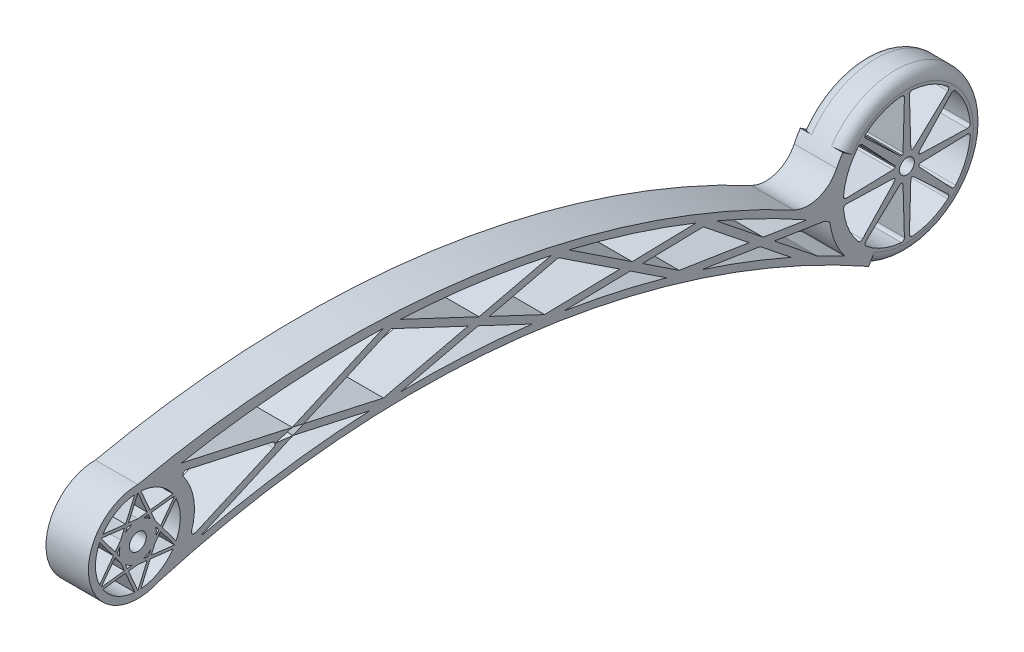
from build123d import *

# Parameters (mm, degrees)
SZKIC1_R                    = 3.0000000000000013
DODANIE_WYCI_GNI_CIE1_DEPTH = 15
WYTNIJ_WYCI_GNI_CIE1_DEPTH  = 10
WYCI_CIE_OBR_T1_ANGLE       = 265.00000000000114
SZKIC4_R                    = 2.6413389418962936
WYTNIJ_WYCI_GNI_CIE2_DEPTH  = 303.97760364050646
ZAOKR_GLENIE2_R             = 1
ZAOKR_GLENIE3_R             = 1


with BuildPart() as part:
    # Szkic1 → Dodanie-wyciągnięcie1 (new body)
    with BuildSketch(Plane(origin=(0, 0, 0), x_dir=(0, 0, -1), z_dir=(1, 0, 0))):
        with BuildLine():
            ThreePointArc((247.14386905317215, 8.669867048888815), (240.61406501931535, 2.878072518954692), (231.9153380807969, 3.595968226311193))
            ThreePointArc((231.91533808079674, 3.595968226310845), (118.77075205195764, 40.0073705160612), (-1.1369e-13, 35.42522894734333))
            ThreePointArc((-4.263e-14, 35.42522894734323), (-17.11785435479439, 14.288051155696689), (7.115506251416886, 1.9371217802628404))
            ThreePointArc((7.115506251417315, 1.9371217802620322), (135.74126507971314, 12.768875604402524), (258.5290498333885, -27.044095150701935))
            ThreePointArc((258.5290498333885, -27.04409515070196), (298.2105787910556, 5.277608418992131), (247.14386905317215, 8.66986704888883))
        make_face()
        with BuildLine():
            Line((86.71196287585684, 39.85172014852097), (54.59601640433131, 25.63196779323211))
            Line((54.59601640433131, 25.63196779323211), (15.371259061907589, 34.30375562276811))
            ThreePointArc((15.371259061907566, 34.303755622767994), (50.88983633712013, 39.02939222675377), (86.71196287585684, 39.85172014852026))
        make_face(mode=Mode.SUBTRACT)
        with BuildLine():
            Line((120.66797341458721, 26.474058591359295), (92.81176762409336, 39.601392917780196))
            ThreePointArc((92.81176762409333, 39.601392917779435), (119.64227628793515, 37.141826382467116), (146.18032427133483, 32.48804599090431))
            Line((146.18032427133505, 32.488045990905256), (120.66797341458721, 26.474058591359295))
        make_face(mode=Mode.SUBTRACT)
        with BuildLine():
            Line((174.84991399733929, 16.273435518201048), (152.4856105962059, 31.04790711767739))
            ThreePointArc((152.48561059620565, 31.047907117676345), (175.25117753037594, 24.736599669939665), (197.5033063836007, 16.802722872715833))
            Line((197.5033063836011, 16.80272287271687), (174.84991399733929, 16.27343551820105))
        make_face(mode=Mode.SUBTRACT)
        with BuildLine():
            Line((221.16225750591792, 0.6095847652137945), (204.59999742397423, 13.883762677302833))
            ThreePointArc((204.59999742397383, 13.883762677301888), (220.82030475857567, 6.4620426304150556), (236.61307264849492, -1.8306517965149283))
            Line((236.61307264849543, -1.8306517965140139), (221.16225750591792, 0.6095847652137937))
        make_face(mode=Mode.SUBTRACT)
        with BuildLine():
            Line((225.09519841335046, -2.5425549225277746), (242.68994389251247, -5.321394797080412))
            ThreePointArc((242.68994389251213, -5.321394797081041), (243.70994318234705, -5.924383596068367), (244.72775709192354, -6.531053925358094))
            ThreePointArc((244.72775709192354, -6.531053925358092), (246.52918688549187, -13.418645500219824), (250.03832796582145, -19.612997434167806))
            ThreePointArc((250.0383279658215, -19.612997434167767), (245.23804821382785, -17.17093269826796), (240.39847516681735, -14.807693693347915))
            Line((240.39847516681735, -14.807693693347897), (225.09519841335046, -2.5425549225277746))
        make_face(mode=Mode.SUBTRACT)
        with BuildLine():
            Line((21.948305518804606, 8.442680568326235), (54.857709427131326, 23.013746507531437))
            Line((54.857709427131326, 23.013746507531433), (81.99464077533202, 17.014328615868333))
            ThreePointArc((81.99464077533202, 17.01432861586835), (51.77371634755495, 14.113835746266773), (21.948305518804602, 8.442680568326239))
        make_face(mode=Mode.SUBTRACT)
        with BuildLine():
            Line((92.96645720572906, 17.375501728865885), (120.39190957994006, 23.84046161952725))
            Line((120.39190957994006, 23.84046161952725), (139.5065287687862, 14.832630527906328))
            ThreePointArc((139.50652876878618, 14.832630527906247), (116.2815352131982, 16.92843679169067), (92.96645720572909, 17.375501728865856))
        make_face(mode=Mode.SUBTRACT)
        with BuildLine():
            Line((150.7937254579246, 13.21069011139366), (174.1253511988679, 13.755824114037251))
            Line((174.1253511988679, 13.755824114037251), (186.99309654488957, 5.255038967541919))
            ThreePointArc((186.99309654488957, 5.25503896754185), (169.00541672809712, 9.742506904499237), (150.7937254579246, 13.21069011139366))
        make_face(mode=Mode.SUBTRACT)
        with BuildLine():
            Line((199.43547561853376, 1.5100334457813434), (220.11666851402651, -1.7562669130035622))
            Line((220.11666851402651, -1.756266913003562), (231.03905749577325, -10.510249391929378))
            ThreePointArc((231.03905749577322, -10.510249391929449), (215.39163289755328, -4.09424986276332), (199.4354756185338, 1.510033445781346))
        make_face(mode=Mode.SUBTRACT)
        with BuildLine():
            Line((14.20879918361564, 32.00038527896806), (50.73912779284115, 23.924280275258774))
            Line((50.73912779284115, 23.924280275258774), (18.132963053328133, 9.487477415884612))
            ThreePointArc((18.13296305332884, 9.487477415884284), (19.702922404067348, 21.3595918779787), (14.20879918361539, 32.000385278967805))
        make_face(mode=Mode.SUBTRACT)
        Polygon((86.8479757216951, 18.501722324906066), (58.71459803862148, 24.72143402550476), (89.55066806325941, 38.374504463564634), (116.75883122700434, 25.552562489680405), align=None, mode=Mode.SUBTRACT)
        Polygon((178.505925039154, 13.858174450783848), (200.0076292842972, 14.360553077500999), (216.1837276065938, 1.3958727747381339), (191.4594501274222, 5.300720856229939), align=None, mode=Mode.SUBTRACT)
        Polygon((143.8506317788958, 15.549149821934162), (124.30105176752294, 24.761957721206137), (148.74353553806114, 30.523746990843186), (170.46934015705276, 16.17108518145446), align=None, mode=Mode.SUBTRACT)
        with Locations((0, 17.925228947343225)):
            Circle(SZKIC1_R, mode=Mode.SUBTRACT)
    extrude(amount=DODANIE_WYCI_GNI_CIE1_DEPTH)

    # Szkic2 → Wytnij-wyciągnięcie1 (cut)
    with BuildSketch(Plane(origin=(15, 0, 0), x_dir=(0, 0, -1), z_dir=(1, 0, 0))):
        Polygon((-4.749370526585766, 24.47363901774454), (-6.067932211414769, 21.428551243027943), (-8.04577473865806, 18.764099440151195), (-12.990381056766234, 25.425228947343374), align=None)
        with BuildLine():
            Line((-8.6684745877329, 17.92522894734628), (-13.508653760358897, 24.44567935990994))
            ThreePointArc((-13.508653760358897, 24.44567935990994), (-15, 17.925228947345317), (-13.508653760360717, 11.40477853478028))
            Line((-13.508653760360717, 11.40477853478028), (-8.6684745877329, 17.92522894734628))
        make_face()
        with BuildLine():
            Line((-6.355965996783881, 19.362785362535288), (-7.42307488958084, 17.925228947343307))
            Line((-7.42307488958084, 17.925228947343307), (-6.355965996783897, 16.487672532151286))
            ThreePointArc((-6.355965996783898, 16.487672532151286), (-6.516507668923027, 17.92522894734329), (-6.35596599678387, 19.362785362535284))
        make_face()
        with BuildLine():
            Line((-3.711537444790369, 24.353800375914847), (-4.422943373321874, 22.710878758551807))
            ThreePointArc((-4.422943373321875, 22.710878758551807), (-3.258253834461477, 23.568690132586703), (-1.9330226234618175, 24.148435173744325))
            Line((-1.9330226234618204, 24.148435173744335), (-3.711537444790369, 24.353800375914847))
        make_face()
        with BuildLine():
            Line((3.711537444790358, 24.353800375914872), (1.9330226234613614, 24.148435173744467))
            ThreePointArc((1.9330226234613608, 24.148435173744467), (3.2582538344613576, 23.56869013258677), (4.422943373322022, 22.710878758551672))
            Line((4.422943373322023, 22.710878758551672), (3.711537444790358, 24.353800375914872))
        make_face()
        with BuildLine():
            Line((7.4230748895808, 17.925228947343463), (6.355965996783689, 19.36278536253609))
            ThreePointArc((6.355965996783688, 19.36278536253609), (6.476247885951691, 18.648475460531408), (6.516507668923027, 17.925228947343225))
            ThreePointArc((6.516507668923027, 17.925228947343225), (6.476247885951745, 17.201982434155514), (6.355965996783897, 16.487672532151283))
            Line((6.355965996783897, 16.487672532151283), (7.4230748895808, 17.925228947343463))
        make_face()
        with BuildLine():
            ThreePointArc((4.422943373321714, 13.139579136134493), (3.2582538344618652, 12.281767762099971), (1.9330226234628807, 11.702022720942455))
            Line((1.9330226234628818, 11.702022720942455), (3.7115374447905536, 11.496657518772196))
            Line((3.7115374447905536, 11.496657518772196), (4.422943373321715, 13.139579136134497))
        make_face()
        with BuildLine():
            ThreePointArc((-1.9330226234626287, 11.702022720942377), (-3.258253834461411, 12.281767762099712), (-4.422943373321141, 13.139579136133964))
            Line((-4.422943373321139, 13.139579136133964), (-3.71153744479015, 11.49665751877212))
            Line((-3.71153744479015, 11.49665751877212), (-1.9330226234626273, 11.702022720942377))
        make_face()
        Polygon((-12.990381056766198, 10.425228947343442), (-4.749370526581913, 11.376818876942833), (-6.0679322114113035, 14.421906651660326), (-8.045774738655652, 17.08635845453843), align=None)
        Polygon((3.296404212072303, 25.31250951055219), (-1.50201e-11, 24.931873538710896), (-3.296404212073718, 25.312509510548917), (0, 32.92522894734322), align=None)
        with BuildLine():
            ThreePointArc((12.401202581576591, 26.36384106846232), (7.499999999999998, 30.915610004109805), (1.1074511787841261, 32.88429148102526))
            Line((1.107451178784127, 32.88429148102526), (4.334237293867699, 25.432348152381884))
            Line((4.3342372938677, 25.432348152381884), (12.40120258157659, 26.36384106846232))
        make_face()
        with BuildLine():
            ThreePointArc((-1.1074511787841275, 32.88429148102526), (-7.500000000001618, 30.91561000410887), (-12.401202581578698, 26.363841068459223))
            Line((-12.401202581578696, 26.363841068459223), (-4.334237293869107, 25.432348152378626))
            Line((-4.334237293869108, 25.432348152378626), (-1.107451178784128, 32.884291481025265))
        make_face()
        Polygon((12.990381056766461, 25.425228947343413), (4.749370526585762, 24.47363901774456), (6.067932211414603, 21.42855124302833), (8.04577473865805, 18.764099440151334), align=None)
        with BuildLine():
            ThreePointArc((15, 17.925228947343225), (14.622410991444106, 21.269641720506044), (13.508653760360719, 24.445679359906165))
            Line((13.508653760360717, 24.445679359906165), (8.668474587735332, 17.925228947343403))
            Line((8.668474587735332, 17.925228947343403), (13.508653760360719, 11.40477853478029))
            ThreePointArc((13.508653760360719, 11.404778534780288), (14.622410991444108, 14.580816174180413), (15, 17.92522894734322))
        make_face()
        Polygon((4.749370526585941, 11.3768188769425), (6.067932211414883, 14.421906651659038), (8.045774738658086, 17.08635845453556), (12.990381056766541, 10.425228947343602), align=None)
        with BuildLine():
            Line((-4.3342372938637315, 10.418109742305223), (-12.401202581576582, 9.48661682622412))
            ThreePointArc((-12.401202581576586, 9.486616826224122), (-7.49999999999809, 4.9348478905755435), (-1.1074511787797334, 2.966166413660863))
            Line((-1.107451178779732, 2.966166413660864), (-4.334237293863731, 10.418109742305223))
        make_face()
        Polygon((2.5337e-13, 2.9252289473436637), (3.2964042120724173, 10.537948384134655), (3.8684e-13, 10.918584355974176), (-3.296404212071974, 10.537948384134525), align=None)
        with BuildLine():
            Line((4.334237293867797, 10.418109742304964), (1.1074511787841348, 2.966166413661188))
            ThreePointArc((1.107451178784139, 2.96616641366119), (7.500000000000208, 4.934847890576766), (12.401202581576863, 9.48661682622453))
            Line((12.401202581576863, 9.486616826224532), (4.334237293867796, 10.418109742304964))
        make_face()
    extrude(amount=-WYTNIJ_WYCI_GNI_CIE1_DEPTH, mode=Mode.SUBTRACT)

    # Szkic3 → Wycięcie-obrót1 (revolve, cut)
    with BuildSketch(Plane(origin=(0, -116.95960868066354, -207.9590871503928), x_dir=(1, 0, 0), z_dir=(0, 0.49020591019126136, 0.8716066576234701))):
        with BuildLine():
            ThreePointArc((14.999999999999996, 107.16065480170373), (13.82842712474619, 104.33222767695754), (11.000000000000004, 103.16065480170373))
            Line((11.000000000000004, 103.16065480170374), (15, 103.16065480170374))
            Line((15, 103.16065480170374), (15, 107.16065480170373))
        make_face()
        with BuildLine():
            Line((0, 103.16065480170374), (3.9999999999999973, 103.16065480170374))
            ThreePointArc((3.9999999999999973, 103.16065480170373), (1.1715728752538102, 104.33222767695754), (1.78e-15, 107.16065480170373))
            Line((0, 107.16065480170373), (0, 103.16065480170374))
        make_face()
    revolve(axis=Axis((15, -3.0749120660565206, -272.0097123636482), (1, 0, 0)), revolution_arc=WYCI_CIE_OBR_T1_ANGLE, mode=Mode.SUBTRACT)

    # Szkic4 → Wytnij-wyciągnięcie2 (cut, through all)
    with BuildSketch(Plane.ZY):
        with BuildLine():
            Line((-276.28696164373895, -4.473174772404359), (-294.49354358999744, -3.9277504945065007))
            ThreePointArc((-294.49354358999744, -3.9277504945064985), (-292.7970018451521, -11.68528929427105), (-288.51122972686704, -18.3703337572485))
            Line((-288.51122972686704, -18.370333757248503), (-276.02290537596446, -5.1106629952951685))
            ThreePointArc((-276.02290537596446, -5.1106629952951685), (-276.167170259949, -4.796987511699434), (-276.28696164373895, -4.473174772404361))
        make_face()
        with BuildLine():
            ThreePointArc((-288.51122972686704, 12.220509625135447), (-292.7970018451521, 5.535465162158003), (-294.49354358999744, -2.222073637606548))
            Line((-294.49354358999744, -2.222073637606547), (-276.28696164373895, -1.6766493597086827))
            ThreePointArc((-276.28696164373895, -1.6766493597086796), (-276.167170259949, -1.3528366204136075), (-276.02290537596446, -1.0391611368178704))
            Line((-276.02290537596446, -1.0391611368178726), (-288.51122972686704, 12.220509625135435))
        make_face()
        with BuildLine():
            Line((-274.04546329288684, -7.0881050783727915), (-287.30513405484015, -19.5764294292754))
            ThreePointArc((-287.30513405484015, -19.57642942927539), (-280.6200895918627, -23.86220154756045), (-272.8625507920982, -25.55874329240578))
            Line((-272.8625507920982, -25.558743292405815), (-273.40797506999604, -7.352161346147302))
            ThreePointArc((-273.40797506999604, -7.352161346147286), (-273.7317878092911, -7.232369962357328), (-274.04546329288684, -7.088105078372793))
        make_face()
        with BuildLine():
            ThreePointArc((-272.86255079209815, 19.408919160292744), (-280.62008959186267, 17.71237741544742), (-287.30513405484015, 13.426605297162352))
            Line((-287.30513405484015, 13.426605297162359), (-274.04546329288684, 0.9382809462597503))
            ThreePointArc((-274.04546329288684, 0.9382809462597517), (-273.73178780929106, 1.0825458302442947), (-273.407975069996, 1.2023372140342583))
            Line((-273.407975069996, 1.2023372140342339), (-272.86255079209815, 19.408919160292747))
        make_face()
        with BuildLine():
            Line((-270.6114496573004, -7.352161346147302), (-271.15687393519823, -25.558743292405815))
            ThreePointArc((-271.15687393519823, -25.558743292405783), (-263.3993351354337, -23.86220154756046), (-256.71429067245623, -19.576429429275397))
            Line((-256.71429067245623, -19.5764294292754), (-269.97396143440955, -7.0881050783727915))
            ThreePointArc((-269.97396143440955, -7.088105078372795), (-270.2876369180053, -7.232369962357339), (-270.6114496573004, -7.352161346147303))
        make_face()
        with BuildLine():
            ThreePointArc((-256.71429067245623, 13.426605297162352), (-263.39933513543366, 17.71237741544741), (-271.1568739351982, 19.40891916029274))
            Line((-271.1568739351982, 19.408919160292747), (-270.6114496573003, 1.2023372140342339))
            ThreePointArc((-270.6114496573003, 1.2023372140342246), (-270.2876369180052, 1.0825458302442645), (-269.9739614344095, 0.9382809462597286))
            Line((-269.9739614344095, 0.9382809462597503), (-256.71429067245623, 13.426605297162359))
        make_face()
        with BuildLine():
            Line((-267.99651935133187, -5.1106629952951685), (-255.5081950004293, -18.370333757248503))
            ThreePointArc((-255.50819500042934, -18.370333757248492), (-251.22242288214426, -11.68528929427105), (-249.52588113729894, -3.927750494506487))
            Line((-249.5258811372989, -3.927750494506492), (-267.7324630835575, -4.473174772404358))
            ThreePointArc((-267.73246308355743, -4.473174772404381), (-267.8522544673474, -4.796987511699431), (-267.9965193513319, -5.110662995295149))
        make_face()
        with BuildLine():
            ThreePointArc((-249.52588113729894, -2.222073637606534), (-251.22242288214426, 5.535465162158001), (-255.50819500042934, 12.220509625135442))
            Line((-255.5081950004293, 12.220509625135461), (-267.9965193513318, -1.0391611368178726))
            ThreePointArc((-267.9965193513319, -1.039161136817916), (-267.8522544673474, -1.3528366204136228), (-267.73246308355743, -1.6766493597086622))
            Line((-267.7324630835575, -1.6766493597086818), (-249.52588113729902, -2.2220736376065378))
        make_face()
        with Locations((-272.0097123636482, -3.074912066056521)):
            Circle(SZKIC4_R)
    extrude(amount=-WYTNIJ_WYCI_GNI_CIE2_DEPTH, mode=Mode.SUBTRACT)

    # Zaokrąglenie2
    # the kernel refuses this fillet: 1 mm, written as the material it adds along each edge
    with BuildSketch(Plane(origin=(0, -1.0391611368178943, -267.99651935133187), x_dir=(0, 0.7279633723747813, 0.6856160211669035), z_dir=(1, 0, 0))) as zaokr_glenie2_piece_1:
        with BuildLine():
            CenterArc((0.6523105054833352, 1.0000000000000013), ZAOKR_GLENIE2_R, 207.33683466870096, 62.663165331297364)
            ThreePointArc((-0.2360116840668876, 0.5407792605372268), (-0.10913296990104362, 0.27426200786756466), (0, 0))
            Line((0, 0), (0.652310505483306, 2e-17))
        make_face()
    extrude(amount=15)
    with BuildSketch(Plane(origin=(0, -1.6766493597086718, -267.7324630835575), x_dir=(0, -0.0299440992044147, 0.9995515749188914), z_dir=(1, 0, 0))) as zaokr_glenie2_piece_2:
        with BuildLine():
            CenterArc((0.6523105054834588, -0.9999999999999998), ZAOKR_GLENIE2_R, 89.99999999999834, 62.663165331299226)
            ThreePointArc((-0.23601168406674122, -0.5407792605372082), (-0.10913296990095891, -0.27426200786755334), (0, 0))
            Line((0, 0), (0.652310505483488, 0))
        make_face()
    extrude(amount=15)
    with BuildSketch(Plane(origin=(0, 12.22050962513545, -255.50819500042934), x_dir=(0, -0.7279633723747962, -0.6856160211668874), z_dir=(1, 0, 0))) as zaokr_glenie2_piece_3:
        with BuildLine():
            CenterArc((1.0970810552204335, -1.000000000000001), ZAOKR_GLENIE2_R, 89.99999999999959, 96.74640415342816)
            ThreePointArc((0.10400522364914143, -1.117475072883543), (0.04503404236574343, -0.5593861125421823), (0, 0))
            Line((0, 0), (1.0970810552204406, -2e-17))
        make_face()
    extrude(amount=15)
    with BuildSketch(Plane(origin=(0, -2.222073637606536, -249.525881137299), x_dir=(0, 0.9980252307388967, -0.0628143200916175), z_dir=(1, 0, 0))) as zaokr_glenie2_piece_4:
        with BuildLine():
            CenterArc((1.0973645020845546, -0.999688947271241), ZAOKR_GLENIE2_R, 88.57088921708781, 96.74640415350945)
            Line((0.10166772912290006, -1.0923600663631525), (0, 0))
            ThreePointArc((0, 0), (0.5611523022023575, 0.00699868639733426), (1.1223046044047162, 0))
        make_face()
    extrude(amount=15)
    with BuildSketch(Plane(origin=(0, -7.0881050783727915, -269.97396143440955), x_dir=(0, -0.3929483772979695, -0.9195605324169217), z_dir=(1, 0, 0))) as zaokr_glenie2_piece_5:
        with BuildLine():
            CenterArc((0.6555967253016459, -0.9978486505165693), ZAOKR_GLENIE2_R, 93.75898856175243, 62.66316533129816)
            Line((-0.26092073406317673, -0.597853967202595), (0, 0))
            ThreePointArc((0, 0), (0.29501852638574716, -0.00968107267543209), (0.5900370527714927, -2e-17))
        make_face()
    extrude(amount=15)
    with BuildSketch(Plane(origin=(0, -7.352161346147303, -270.6114496573004), x_dir=(0, -0.9995515749188927, -0.029944099204370734), z_dir=(1, 0, 0))) as zaokr_glenie2_piece_6:
        with BuildLine():
            CenterArc((0.6523105054833831, -0.9999999999999907), ZAOKR_GLENIE2_R, 90.00000000000158, 62.66316533129891)
            ThreePointArc((-0.2360116840668347, -0.5407792605372477), (-0.10913296990101062, -0.2742620078676106), (0, 0))
            Line((0, 0), (0.6523105054833557, 0))
        make_face()
    extrude(amount=15)
    with BuildSketch(Plane(origin=(0, -19.576429429275393, -256.71429067245623), x_dir=(0, 0.6856160211668924, -0.7279633723747916), z_dir=(1, 0, 0))) as zaokr_glenie2_piece_7:
        with BuildLine():
            CenterArc((1.0970810552251236, -0.9999999999999961), ZAOKR_GLENIE2_R, 89.99999999999919, 96.74640415342623)
            ThreePointArc((0.10400522365383967, -1.1174750728834957), (0.04503404236578149, -0.5593861125424465), (0, 0))
            Line((0, 0), (1.0970810552251378, 0))
        make_face()
    extrude(amount=15)
    with BuildSketch(Plane(origin=(0, -4.473174772404369, -267.7324630835575), x_dir=(0, 0.029944099204419008, 0.9995515749188914), z_dir=(1, 0, 0))) as zaokr_glenie2_piece_8:
        with BuildLine():
            CenterArc((0.6523105054833979, 1.0000000000000002), ZAOKR_GLENIE2_R, 207.33683466870332, 62.663165331298615)
            ThreePointArc((-0.2360116840668, 0.5407792605371928), (-0.10913296990096008, 0.2742620078675522), (0, 0))
            Line((0, 0), (0.6523105054834313, 0))
        make_face()
    extrude(amount=15)
    with BuildSketch(Plane(origin=(0, -7.0881050783727915, -274.04546329288684), x_dir=(0, -0.6856160211668986, -0.7279633723747856), z_dir=(1, 0, 0))) as zaokr_glenie2_piece_9:
        with BuildLine():
            CenterArc((0.652310505483376, -0.9999999999999973), ZAOKR_GLENIE2_R, 90.00000000000139, 62.66316533129475)
            ThreePointArc((-0.2360116840668056, -0.5407792605371874), (-0.10913296990095936, -0.27426200786753413), (0, 0))
            Line((0, 0), (0.6523105054833519, 2e-17))
        make_face()
    extrude(amount=15)
    with BuildSketch(Plane(origin=(0, -7.352161346147294, -273.40797506999604), x_dir=(0, -0.9995515749188927, 0.02994409920437053), z_dir=(1, 0, 0))) as zaokr_glenie2_piece_10:
        with BuildLine():
            CenterArc((0.6523105054833878, 0.9999999999999907), ZAOKR_GLENIE2_R, 207.3368346687031, 62.66316533129532)
            ThreePointArc((-0.23601168406680184, 0.5407792605371918), (-0.10913296990098312, 0.2742620078675546), (0, 0))
            Line((0, 0), (0.65231050548336, 0))
        make_face()
    extrude(amount=15)
    with BuildSketch(Plane(origin=(0, -3.9277504945064896, -249.52588113729894), x_dir=(0, -0.02994409920440287, -0.9995515749188917), z_dir=(1, 0, 0))) as zaokr_glenie2_piece_11:
        with BuildLine():
            CenterArc((1.097081055223315, -1), ZAOKR_GLENIE2_R, 89.99999999999936, 96.74640415355515)
            ThreePointArc((0.10400522365228276, -1.1174750728857392), (0.04503404236584158, -0.5593861125434373), (0, 0))
            Line((0, 0), (1.097081055223326, 0))
        make_face()
    extrude(amount=15)
    with BuildSketch(Plane(origin=(0, -18.370333757248495, -255.50819500042934), x_dir=(0, 0.7501268401431951, 0.6612939767582837), z_dir=(1, 0, 0))) as zaokr_glenie2_piece_12:
        with BuildLine():
            CenterArc((1.0973645020849179, -0.999688947271231), ZAOKR_GLENIE2_R, 88.5708892170913, 96.74640415351087)
            Line((0.10166772912327839, -1.0923600663632267), (0, 0))
            ThreePointArc((0, 0), (0.5611523022025391, 0.00699868639729401), (1.1223046044050182, 0))
        make_face()
    extrude(amount=15)
    with BuildSketch(Plane(origin=(0, 19.40891916029274, -272.86255079209815), x_dir=(0, -0.0628143200916797, -0.9980252307388927), z_dir=(1, 0, 0))) as zaokr_glenie2_piece_13:
        with BuildLine():
            CenterArc((1.0973645020844052, -0.9996889472712321), ZAOKR_GLENIE2_R, 88.57088921709108, 96.74640415349302)
            Line((0.10166772912271652, -1.0923600663629165), (0, 0))
            ThreePointArc((0, 0), (0.5611523022022534, 0.00699868639729153), (1.1223046044045095, -1e-17))
        make_face()
    extrude(amount=15)
    with BuildSketch(Plane(origin=(0, -1.0391611368178713, -276.02290537596446), x_dir=(0, 0.7279633723748022, -0.6856160211668811), z_dir=(1, 0, 0))) as zaokr_glenie2_piece_14:
        with BuildLine():
            CenterArc((0.6523105054834076, -1.0000000000000024), ZAOKR_GLENIE2_R, 89.99999999999986, 62.66316533129617)
            ThreePointArc((-0.2360116840667847, -0.5407792605371852), (-0.10913296990100531, -0.2742620078675173), (0, 0))
            Line((0, 0), (0.6523105054834102, 0))
        make_face()
    extrude(amount=15)
    with BuildSketch(Plane(origin=(0, -4.47317477240436, -276.28696164373895), x_dir=(0, 0.029944099204399964, -0.9995515749188919), z_dir=(1, 0, 0))) as zaokr_glenie2_piece_15:
        with BuildLine():
            CenterArc((0.6523105054834165, -1.0000000000000002), ZAOKR_GLENIE2_R, 89.99999999999919, 62.663165331300476)
            ThreePointArc((-0.23601168406679118, -0.5407792605372461), (-0.10913296990101273, -0.2742620078675881), (0, 0))
            Line((0, 0), (0.6523105054834308, 0))
        make_face()
    extrude(amount=15)
    with BuildSketch(Plane(origin=(0, 12.220509625135442, -288.51122972686704), x_dir=(0, -0.7279633723747974, 0.685616021166886), z_dir=(1, 0, 0))) as zaokr_glenie2_piece_16:
        with BuildLine():
            CenterArc((1.097081055222594, 1.0000000000000022), ZAOKR_GLENIE2_R, 173.2535958464652, 96.74640415353502)
            ThreePointArc((0.10400522365152876, 1.1174750728853988), (0.04503404236581977, 0.5593861125432292), (0, 0))
            Line((0, 0), (1.0970810552225982, 1.1e-16))
        make_face()
    extrude(amount=15)
    with BuildSketch(Plane(origin=(0, -18.370333757248495, -288.51122972686704), x_dir=(0, 0.7501268401431492, -0.6612939767583358), z_dir=(1, 0, 0))) as zaokr_glenie2_piece_17:
        with BuildLine():
            CenterArc((1.0973645020820684, 0.999688947271243), ZAOKR_GLENIE2_R, 174.68270662956036, 96.74640415334648)
            Line((0.10166772912017569, 1.0923600663604138), (0, 0))
            ThreePointArc((0, 0), (0.5611523022011092, -0.0069986863972657), (1.1223046044021363, -4e-17))
        make_face()
    extrude(amount=15)
    with BuildSketch(Plane(origin=(0, -25.558743292405808, -272.8625507920982), x_dir=(0, 0.9995515749188911, -0.029944099204423556), z_dir=(1, 0, 0))) as zaokr_glenie2_piece_18:
        with BuildLine():
            CenterArc((1.0970810552235708, -0.9999999999999907), ZAOKR_GLENIE2_R, 90.00000000000135, 96.74640415371641)
            ThreePointArc((0.10400522365287737, -1.117475072888559), (0.0450340423660103, -0.5593861125448855), (0, 0))
            Line((0, 0), (1.0970810552235473, 0))
        make_face()
    extrude(amount=15)
    with BuildSketch(Plane(origin=(0, -5.1106629952951685, -276.02290537596446), x_dir=(0, 0.919560532416912, -0.3929483772979924), z_dir=(1, 0, 0))) as zaokr_glenie2_piece_19:
        with BuildLine():
            CenterArc((0.6555967253016699, -0.9978486505165827), ZAOKR_GLENIE2_R, 93.75898856175532, 62.66316533129684)
            Line((-0.26092073406316724, -0.5978539672026318), (0, 0))
            ThreePointArc((0, 0), (0.2950185263857061, -0.00968107267540476), (0.5900370527714652, 0))
        make_face()
    extrude(amount=15)
    with BuildSketch(Plane(origin=(0, -1.6766493597086811, -276.28696164373895), x_dir=(0, 0.9280839504271531, 0.3723710259398945), z_dir=(1, 0, 0))) as zaokr_glenie2_piece_20:
        with BuildLine():
            CenterArc((0.655596725301614, -0.9978486505165761), ZAOKR_GLENIE2_R, 93.75898856175117, 62.66316533129951)
            Line((-0.26092073406321087, -0.5978539672026022), (0, 0))
            ThreePointArc((0, 0), (0.29501852638574616, -0.00968107267543258), (0.5900370527714822, -1e-17))
        make_face()
    extrude(amount=15)
    with BuildSketch(Plane(origin=(0, 0.9382809462597499, -274.04546329288684), x_dir=(0, 0.3929483772979587, 0.9195605324169264), z_dir=(1, 0, 0))) as zaokr_glenie2_piece_21:
        with BuildLine():
            CenterArc((0.6555967253016313, -0.9978486505165703), ZAOKR_GLENIE2_R, 93.75898856175176, 62.6631653312982)
            Line((-0.2609207340631863, -0.5978539672025861), (0, 0))
            ThreePointArc((0, 0), (0.2950185263856894, -0.00968107267544525), (0.5900370527714898, -1e-17))
        make_face()
    extrude(amount=15)
    with BuildSketch(Plane(origin=(0, 1.2023372140342476, -273.407975069996), x_dir=(0, -0.37237102593985144, -0.9280839504271703), z_dir=(1, 0, 0))) as zaokr_glenie2_piece_22:
        with BuildLine():
            CenterArc((0.6555967253016637, 0.997848650516569), ZAOKR_GLENIE2_R, 203.57784610694745, 62.66316533129884)
            Line((-0.26092073406316585, 0.597853967202629), (0, 0))
            ThreePointArc((0, 0), (0.29501852638578246, 0.00968107267544045), (0.5900370527714887, 1e-17))
        make_face()
    extrude(amount=15)
    with BuildSketch(Plane(origin=(0, -25.5587432924058, -271.15687393519823), x_dir=(0, 0.9995515749188923, 0.029944099204384587), z_dir=(1, 0, 0))) as zaokr_glenie2_piece_23:
        with BuildLine():
            CenterArc((1.0970810552230614, 0.9999999999999908), ZAOKR_GLENIE2_R, 173.2535958464512, 96.74640415354969)
            ThreePointArc((0.10400522365202086, 1.1174750728856304), (0.04503404236585731, 0.5593861125433557), (0, 0))
            Line((0, 0), (1.097081055223077, 0))
        make_face()
    extrude(amount=15)
    with BuildSketch(Plane(origin=(0, -19.576429429275393, -287.30513405484015), x_dir=(0, -0.6612939767582722, 0.7501268401432053), z_dir=(1, 0, 0))) as zaokr_glenie2_piece_24:
        with BuildLine():
            CenterArc((1.0973645020850624, -0.9996889472712236), ZAOKR_GLENIE2_R, 88.57088921709014, 96.74640415347397)
            Line((0.10166772912333646, -1.0923600663625608), (0, 0))
            ThreePointArc((0, 0), (0.5611523022025832, 0.0069986863973205), (1.122304604405183, -8e-17))
        make_face()
    extrude(amount=15)
    with BuildSketch(Plane(origin=(0, 13.426605297162357, -287.30513405484015), x_dir=(0, -0.6856160211668926, 0.7279633723747914), z_dir=(1, 0, 0))) as zaokr_glenie2_piece_25:
        with BuildLine():
            CenterArc((1.0970810552249661, -0.9999999999999974), ZAOKR_GLENIE2_R, 89.99999999999909, 96.74640415341389)
            ThreePointArc((0.10400522365364945, -1.1174750728832827), (0.04503404236576309, -0.5593861125423), (0, 0))
            Line((0, 0), (1.097081055224982, 6e-17))
        make_face()
    extrude(amount=15)
    with BuildSketch(Plane(origin=(0, -2.2220736376065475, -294.49354358999744), x_dir=(0, 0.029944099204400044, 0.9995515749188918), z_dir=(1, 0, 0))) as zaokr_glenie2_piece_26:
        with BuildLine():
            CenterArc((1.0970810552192176, -1), ZAOKR_GLENIE2_R, 90.00000000000082, 96.74640415357771)
            ThreePointArc((0.10400522364822598, -1.1174750728861569), (0.04503404236586946, -0.5593861125434717), (0, 0))
            Line((0, 0), (1.0970810552192032, 0))
        make_face()
    extrude(amount=15)
    with BuildSketch(Plane(origin=(0, -3.9277504945064994, -294.49354358999744), x_dir=(0, -0.9980252307388935, 0.0628143200916681), z_dir=(1, 0, 0))) as zaokr_glenie2_piece_27:
        with BuildLine():
            CenterArc((1.0973645020846017, -0.999688947271214), ZAOKR_GLENIE2_R, 88.57088921709041, 96.74640415347722)
            Line((0.10166772912289936, -1.0923600663626098), (0, 0))
            ThreePointArc((0, 0), (0.5611523022023599, 0.00699868639727746), (1.1223046044047171, 0))
        make_face()
    extrude(amount=15)
    with BuildSketch(Plane(origin=(0, -5.110662995295159, -267.9965193513319), x_dir=(0, -0.7279633723747678, 0.6856160211669177), z_dir=(1, 0, 0))) as zaokr_glenie2_piece_28:
        with BuildLine():
            CenterArc((0.6523105054834235, -1.0000000000000018), ZAOKR_GLENIE2_R, 90.00000000000276, 62.66316533129742)
            ThreePointArc((-0.2360116840668088, -0.5407792605372452), (-0.10913296990096921, -0.27426200786757987), (0, 0))
            Line((0, 0), (0.6523105054833754, 2e-17))
        make_face()
    extrude(amount=15)
    with BuildSketch(Plane(origin=(0, 1.2023372140342308, -270.6114496573003), x_dir=(0, -0.3723710259398735, 0.9280839504271615), z_dir=(1, 0, 0))) as zaokr_glenie2_piece_29:
        with BuildLine():
            CenterArc((0.6555967253015856, -0.9978486505165678), ZAOKR_GLENIE2_R, 93.75898856175588, 62.663165331295104)
            Line((-0.26092073406323313, -0.5978539672026025), (0, 0))
            ThreePointArc((0, 0), (0.2950185263857252, -0.009681072675437), (0.5900370527713719, 1e-17))
        make_face()
    extrude(amount=15)
    with BuildSketch(Plane(origin=(0, 0.9382809462597388, -269.9739614344095), x_dir=(0, 0.3929483772979667, -0.919560532416923), z_dir=(1, 0, 0))) as zaokr_glenie2_piece_30:
        with BuildLine():
            CenterArc((0.6555967253016427, 0.9978486505165707), ZAOKR_GLENIE2_R, 203.57784610694952, 62.66316533129822)
            Line((-0.26092073406317845, 0.5978539672025945), (0, 0))
            ThreePointArc((0, 0), (0.29501852638574405, 0.00968107267542566), (0.590037052771492, -3e-17))
        make_face()
    extrude(amount=15)
    with BuildSketch(Plane(origin=(0, 19.408919160292754, -271.1568739351982), x_dir=(0, -0.9995515749188921, 0.029944099204391464), z_dir=(1, 0, 0))) as zaokr_glenie2_piece_31:
        with BuildLine():
            CenterArc((1.0970810552228125, -0.9999999999999909), ZAOKR_GLENIE2_R, 89.9999999999993, 96.74640415323273)
            ThreePointArc((0.10400522365112481, -1.1174750728801404), (0.0450340423655877, -0.5593861125406339), (0, 0))
            Line((0, 0), (1.0970810552228247, 0))
        make_face()
    extrude(amount=15)
    with BuildSketch(Plane(origin=(0, 13.42660529716235, -256.71429067245623), x_dir=(0, 0.6612939767582956, -0.7501268401431846), z_dir=(1, 0, 0))) as zaokr_glenie2_piece_32:
        with BuildLine():
            CenterArc((1.0973645020842948, -0.9996889472712337), ZAOKR_GLENIE2_R, 88.57088921709214, 96.74640415351041)
            Line((0.1016677291226324, -1.0923600663632378), (0, 0))
            ThreePointArc((0, 0), (0.561152302202194, 0.00699868639729109), (1.1223046044043805, 0))
        make_face()
    extrude(amount=15)

    # Zaokrąglenie3
    zaokr_glenie3_edges = [part.edges().sort_by_distance(p)[0] for p in [
        (7.5, 23.924280275258774, -50.73912779284115),
        (7.5, 32.00038527896793, -14.208799183615517),
        (7.5, 9.487477415884449, -18.13296305332849),
    ]]
    fillet(zaokr_glenie3_edges, radius=ZAOKR_GLENIE3_R)


solid = part.part
